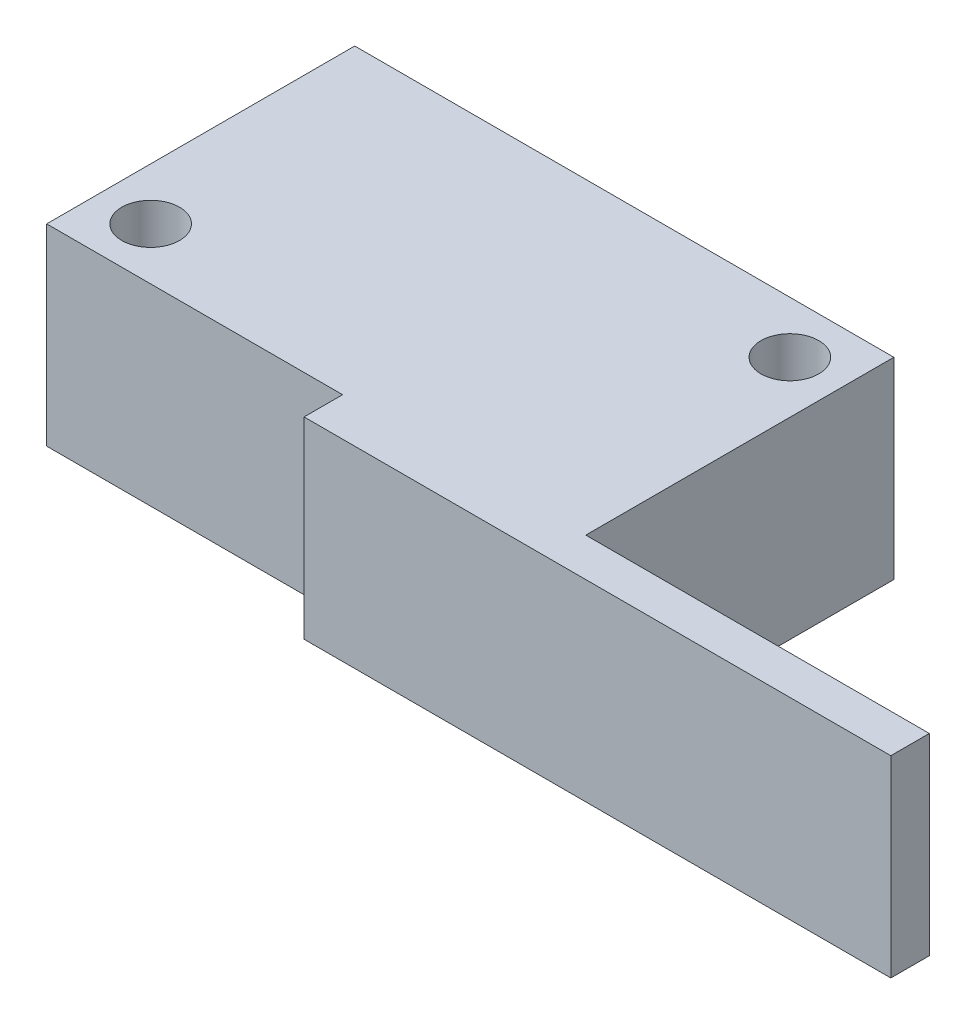
from build123d import *

# Parameters (mm, degrees)
SKETCH1_W           = 28
SKETCH1_H           = 16
BOSS_EXTRUDE1_DEPTH = 10
CUT_EXTRUDE1_REACH  = 20.974
SKETCH2_R           = 1.5
SKETCH3_W           = 30.473772143
SKETCH3_H           = 10
BOSS_EXTRUDE2_DEPTH = 2


with BuildPart() as part:
    # Sketch1 → Boss-Extrude1 (new body)
    with BuildSketch(Plane(origin=(0, 0, 0), x_dir=(1, 0, 0), z_dir=(0, 1, 0))):
        Rectangle(SKETCH1_W, SKETCH1_H)
    extrude(amount=BOSS_EXTRUDE1_DEPTH)

    # Sketch2 → Cut-Extrude1 (cut, up to next)
    with BuildSketch(Plane(origin=(0, 10, 0), x_dir=(1, 0, 0), z_dir=(0, 1, 0)), mode=Mode.PRIVATE) as cut_extrude1_sk1:
        with Locations((-11.3, -5.3)):
            Circle(SKETCH2_R)
    cut_extrude1_tool1 = extrude(cut_extrude1_sk1.sketch, amount=-CUT_EXTRUDE1_REACH, mode=Mode.PRIVATE) & part.part
    # Sketch2 → Cut-Extrude1 (cut, up to next)
    with BuildSketch(Plane(origin=(0, 10, 0), x_dir=(1, 0, 0), z_dir=(0, 1, 0)), mode=Mode.PRIVATE) as cut_extrude1_sk2:
        with Locations((11.3, 5.3)):
            Circle(SKETCH2_R)
    cut_extrude1_tool2 = extrude(cut_extrude1_sk2.sketch, amount=-CUT_EXTRUDE1_REACH, mode=Mode.PRIVATE) & part.part
    add(cut_extrude1_tool1.solids().sort_by_distance((-11.3, 10, 5.3))[0], mode=Mode.SUBTRACT)
    add(cut_extrude1_tool2.solids().sort_by_distance((11.3, 10, -5.3))[0], mode=Mode.SUBTRACT)

    # Sketch3 → Boss-Extrude2 (add)
    with BuildSketch(Plane.XY.offset(8)):
        with Locations((16.605084713, 5)):
            Rectangle(SKETCH3_W, SKETCH3_H)
    extrude(amount=BOSS_EXTRUDE2_DEPTH)


solid = part.part
